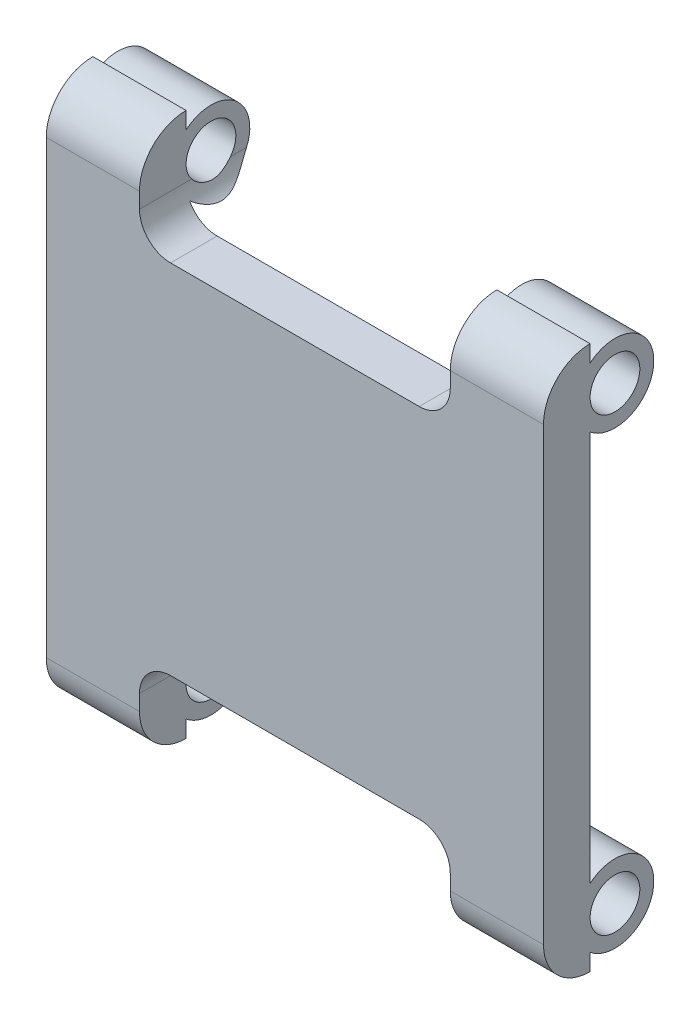
from build123d import *

# Parameters (mm, degrees)
SKETCH1_W                       = 32
SKETCH1_H                       = 35
BOSS_EXTRUDE1_DEPTH             = 3
BOSS_EXTRUDE2_REACH             = 40.601
SKETCH4_R                       = 2.5
SKETCH4_R_2                     = 1.6
BOSS_EXTRUDE2_DIRECTION_2_REACH = 40.601
CUT_EXTRUDE1_DEPTH              = 40.133233958
FILLET1_R                       = 3


with BuildPart() as part:
    # Sketch1 → Boss-Extrude1 (new body)
    with BuildSketch(Plane.XY):
        with Locations((0, 17.5)):
            Rectangle(SKETCH1_W, SKETCH1_H)
    extrude(amount=BOSS_EXTRUDE1_DEPTH)

    # Boss-Extrude2: up to this face of the body (flat: up to its plane)
    boss_extrude2_end = Plane(part.part.faces().sort_by_distance((16, 17.5, 1.5))[0])
    # Sketch4 → Boss-Extrude2 (add, up to the picked face)
    with BuildSketch(Plane(origin=(0, 0, 0), x_dir=(0, 0, -1), z_dir=(1, 0, 0)), mode=Mode.PRIVATE) as boss_extrude2_sk1:
        with Locations((1.6, 32)):
            Circle(SKETCH4_R)
        with Locations(Location((1.6, 32, 0), (0, 0, 180))):
            Circle(SKETCH4_R_2, mode=Mode.SUBTRACT)
    boss_extrude2_tool1 = split(extrude(boss_extrude2_sk1.sketch, amount=BOSS_EXTRUDE2_REACH, mode=Mode.PRIVATE), bisect_by=boss_extrude2_end, keep=Keep.BOTH, mode=Mode.PRIVATE)
    # Sketch4 → Boss-Extrude2 (add, up to the picked face)
    with BuildSketch(Plane(origin=(0, 0, 0), x_dir=(0, 0, -1), z_dir=(1, 0, 0)), mode=Mode.PRIVATE) as boss_extrude2_sk2:
        with Locations((1.6, 3)):
            Circle(SKETCH4_R)
        with Locations(Location((1.6, 3, 0), (0, 0, 180))):
            Circle(SKETCH4_R_2, mode=Mode.SUBTRACT)
    boss_extrude2_tool2 = split(extrude(boss_extrude2_sk2.sketch, amount=BOSS_EXTRUDE2_REACH, mode=Mode.PRIVATE), bisect_by=boss_extrude2_end, keep=Keep.BOTH, mode=Mode.PRIVATE)
    add(boss_extrude2_tool1.solids().sort_by(Axis((0, 32, 0.829289), (1, 0, 0)))[0])
    add(boss_extrude2_tool2.solids().sort_by(Axis((0, 3, 0.829289), (1, 0, 0)))[0])

    # Boss-Extrude2 direction 2: up to this face of the body (flat: up to its plane)
    boss_extrude2_direction_2_end = Plane(part.part.faces().sort_by_distance((-16, 17.5, 1.5))[0])
    # Sketch4 → Boss-Extrude2 direction 2 (add, up to the picked face)
    with BuildSketch(Plane(origin=(0, 0, 0), x_dir=(0, 0, -1), z_dir=(1, 0, 0)), mode=Mode.PRIVATE) as boss_extrude2_direction_2_sk1:
        with Locations((1.6, 32)):
            Circle(SKETCH4_R)
        with Locations(Location((1.6, 32, 0), (0, 0, 180))):
            Circle(SKETCH4_R_2, mode=Mode.SUBTRACT)
    boss_extrude2_direction_2_tool1 = split(extrude(boss_extrude2_direction_2_sk1.sketch, amount=-BOSS_EXTRUDE2_DIRECTION_2_REACH, mode=Mode.PRIVATE), bisect_by=boss_extrude2_direction_2_end, keep=Keep.BOTH, mode=Mode.PRIVATE)
    # Sketch4 → Boss-Extrude2 direction 2 (add, up to the picked face)
    with BuildSketch(Plane(origin=(0, 0, 0), x_dir=(0, 0, -1), z_dir=(1, 0, 0)), mode=Mode.PRIVATE) as boss_extrude2_direction_2_sk2:
        with Locations((1.6, 3)):
            Circle(SKETCH4_R)
        with Locations(Location((1.6, 3, 0), (0, 0, 180))):
            Circle(SKETCH4_R_2, mode=Mode.SUBTRACT)
    boss_extrude2_direction_2_tool2 = split(extrude(boss_extrude2_direction_2_sk2.sketch, amount=-BOSS_EXTRUDE2_DIRECTION_2_REACH, mode=Mode.PRIVATE), bisect_by=boss_extrude2_direction_2_end, keep=Keep.BOTH, mode=Mode.PRIVATE)
    add(boss_extrude2_direction_2_tool1.solids().sort_by(Axis((0, 32, 0.829289), (-1, 0, 0)))[0])
    add(boss_extrude2_direction_2_tool2.solids().sort_by(Axis((0, 3, 0.829289), (-1, 0, 0)))[0])

    # Sketch5 → Cut-Extrude1 (cut, through all)
    with BuildSketch(Plane.XY.offset(3)):
        with BuildLine():
            Line((-10, 35), (-10, 31))
            ThreePointArc((-10, 31), (-9.414213562, 29.585786438), (-8, 29))
            Line((-8, 29), (8, 29))
            ThreePointArc((8, 29), (9.414213562, 29.585786438), (10, 31))
            Line((10, 31), (10, 35))
            Line((10, 35), (-10, 35))
        make_face()
        with BuildLine():
            Line((-10, 0), (-10, 4))
            ThreePointArc((-10, 4), (-9.414213562, 5.414213562), (-8, 6))
            Line((-8, 6), (8, 6))
            ThreePointArc((8, 6), (9.414213562, 5.414213562), (10, 4))
            Line((10, 4), (10, 0))
            Line((10, 0), (-10, 0))
        make_face()
    extrude(amount=-CUT_EXTRUDE1_DEPTH, mode=Mode.SUBTRACT)

    # Fillet1
    fillet1_edges = [part.edges().sort_by_distance(p)[0] for p in [
        (13, 0, 3),
        (-13, 0, 3),
        (13, 35, 3),
        (-13, 35, 3),
    ]]
    fillet(fillet1_edges, radius=FILLET1_R - 0.0001)  # a hair under: the kernel refuses the full size


solid = part.part
